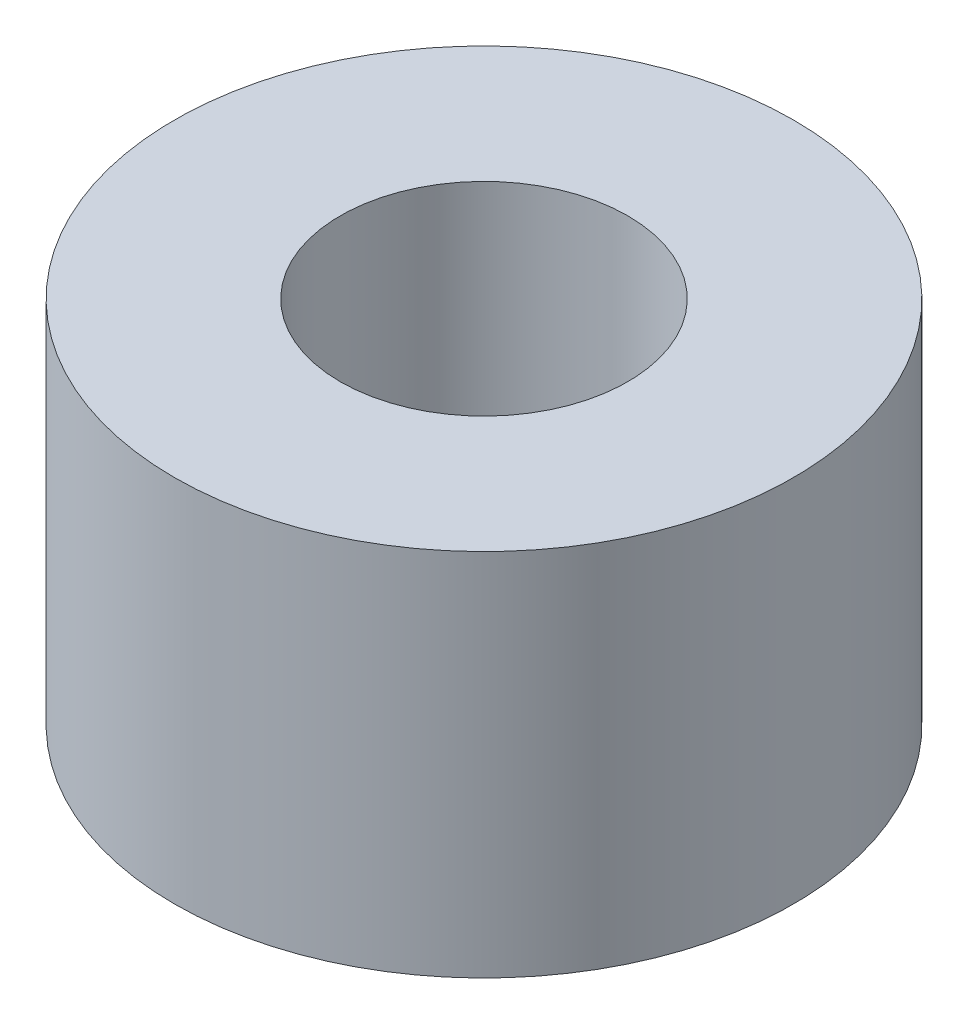
from build123d import *

# Parameters (mm, degrees)
SKETCH1_R           = 3.5
SKETCH1_R_2         = 1.625
BOSS_EXTRUDE1_DEPTH = 2.0875


with BuildPart() as part:
    # Sketch1 → Boss-Extrude1 (new, symmetric)
    with BuildSketch(Plane(origin=(0, 0, 0), x_dir=(1, 0, 0), z_dir=(0, 1, 0))):
        Circle(SKETCH1_R)
        Circle(SKETCH1_R_2, mode=Mode.SUBTRACT)
    extrude(amount=BOSS_EXTRUDE1_DEPTH, both=True)


solid = part.part
